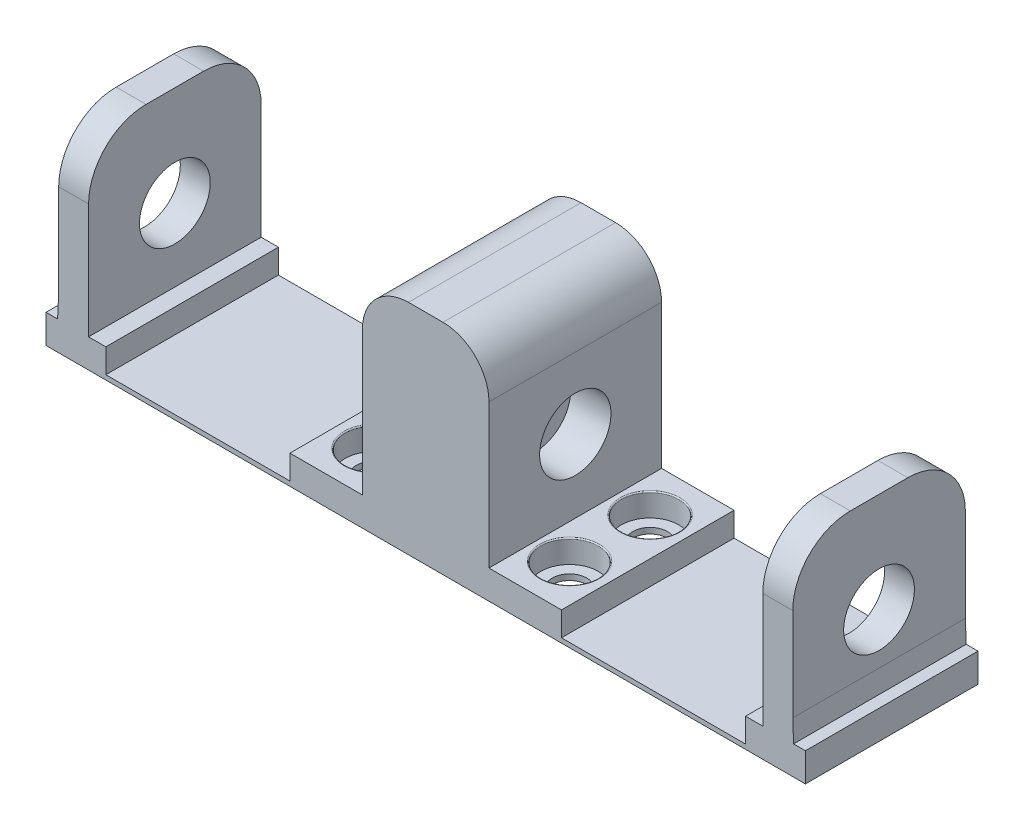
from build123d import *

# Parameters (mm, degrees)
SALIENTE_EXTRUIR1_DEPTH = 15
CROQUIS2_R              = 3.1
CORTAR_EXTRUIR1_DEPTH   = 3.5
CORTAR_EXTRUIR2_START   = -3.5
CROQUIS3_R              = 3.1
CORTAR_EXTRUIR2_DEPTH   = 3.5
CROQUIS4_R              = 2.5
CORTAR_EXTRUIR3_DEPTH   = 2
REDONDEO1_R             = 0.1
CROQUIS5_R              = 1.5
CORTAR_EXTRUIR4_DEPTH   = 26.089838581
CROQUIS6_W              = 15
CROQUIS6_H              = 2.5
SALIENTE_EXTRUIR2_DEPTH = 21.5
CROQUIS7_W              = 15
CROQUIS7_H              = 2.5
SALIENTE_EXTRUIR3_DEPTH = 21.5
CROQUIS8_W              = 2.6
CROQUIS8_H              = 15
SALIENTE_EXTRUIR4_DEPTH = 15
REDONDEO4_R             = 5
REDONDEO5_R             = 5
NERVIO1_REACH           = 37.15
CROQUIS17_WALL_W        = 74.218890724
CROQUIS17_WALL_H        = 15
NERVIO2_REACH           = 37.15
CROQUIS22_WALL_W        = 74.219791664
CROQUIS22_WALL_H        = 15
CROQUIS23_R             = 3.075
CORTAR_EXTRUIR5_DEPTH   = 7
CORTAR_EXTRUIR6_START   = -7
CROQUIS24_R             = 3.075
CORTAR_EXTRUIR6_DEPTH   = 7
CROQUIS34_W             = 16
CROQUIS34_H             = 2.1
CORTAR_EXTRUIR7_DEPTH   = 38.473323845
CROQUIS35_R             = 1.5
CORTAR_EXTRUIR8_DEPTH   = 2.2


with BuildPart() as part:
    # Croquis1 → Saliente-Extruir1 (new body)
    with BuildSketch(Plane.XY):
        with BuildLine():
            Line((-1.5, 9.5), (1.5, 9.5))
            ThreePointArc((1.5, 9.5), (4.328427125, 8.328427125), (5.5, 5.5))
            Line((5.5, 5.5), (5.5, -7))
            Line((5.5, -7), (11.5, -7))
            Line((11.5, -7), (11.5, -9.5))
            Line((11.5, -9.5), (5.5, -9.5))
            Line((5.5, -9.5), (-5.5, -9.5))
            Line((-5.5, -9.5), (-11.5, -9.5))
            Line((-11.5, -9.5), (-11.5, -7))
            Line((-11.5, -7), (-5.5, -7))
            Line((-5.5, -7), (-5.5, 5.5))
            ThreePointArc((-5.5, 5.5), (-4.328427125, 8.328427125), (-1.5, 9.5))
        make_face()
    extrude(amount=-SALIENTE_EXTRUIR1_DEPTH)

    # Croquis2 → Cortar-Extruir1 (cut)
    with BuildSketch(Plane(origin=(5.5, 0, 0), x_dir=(0, 0, -1), z_dir=(1, 0, 0))):
        with Locations((7.5, -0.68)):
            Circle(CROQUIS2_R)
    extrude(amount=-CORTAR_EXTRUIR1_DEPTH, mode=Mode.SUBTRACT)

    # Croquis3 → Cortar-Extruir2 (cut)
    with BuildSketch(Plane.ZY.offset(5.5).offset(CORTAR_EXTRUIR2_START)):
        with Locations((-7.5, -0.68)):
            Circle(CROQUIS3_R)
    extrude(amount=CORTAR_EXTRUIR2_DEPTH, mode=Mode.SUBTRACT)

    # Croquis4 → Cortar-Extruir3 (cut)
    with BuildSketch(Plane(origin=(0, -7, 0), x_dir=(1, 0, 0), z_dir=(0, 1, 0))):
        with Locations((-8.5, 11)):
            Circle(CROQUIS4_R)
        with Locations((-8.5, 4)):
            Circle(CROQUIS4_R)
        with Locations((8.5, 4)):
            Circle(CROQUIS4_R)
        with Locations((8.5, 11)):
            Circle(CROQUIS4_R)
    extrude(amount=-CORTAR_EXTRUIR3_DEPTH, mode=Mode.SUBTRACT)

    # Redondeo1
    redondeo1_edges = [part.edges().sort_by_distance(p)[0] for p in [
        (6, -7, -4),
        (6, -7, -11),
        (-11, -7, -4),
        (-11, -7, -11),
    ]]
    fillet(redondeo1_edges, radius=REDONDEO1_R)

    # Croquis5 → Cortar-Extruir4 (cut, through all)
    with BuildSketch(Plane(origin=(0, -7, 0), x_dir=(1, 0, 0), z_dir=(0, 1, 0))):
        with Locations((-8.5, 11)):
            Circle(CROQUIS5_R)
        with Locations((-8.5, 4)):
            Circle(CROQUIS5_R)
        with Locations((8.5, 4)):
            Circle(CROQUIS5_R)
        with Locations((8.5, 11)):
            Circle(CROQUIS5_R)
    extrude(amount=-CORTAR_EXTRUIR4_DEPTH, mode=Mode.SUBTRACT)

    # Croquis6 → Saliente-Extruir2 (add)
    with BuildSketch(Plane.ZY.offset(11.5)):
        with Locations((-7.5, -8.25)):
            Rectangle(CROQUIS6_W, CROQUIS6_H)
    extrude(amount=SALIENTE_EXTRUIR2_DEPTH)

    # Croquis7 → Saliente-Extruir3 (add)
    with BuildSketch(Plane(origin=(11.5, 0, 0), x_dir=(0, 0, -1), z_dir=(1, 0, 0))):
        with Locations((7.5, -8.25)):
            Rectangle(CROQUIS7_W, CROQUIS7_H)
    extrude(amount=SALIENTE_EXTRUIR3_DEPTH)

    # Croquis8 → Saliente-Extruir4 (add)
    with BuildSketch(Plane(origin=(0, -7, 0), x_dir=(1, 0, 0), z_dir=(0, 1, 0))):
        with Locations((-30.6, 7.5)):
            Rectangle(CROQUIS8_W, CROQUIS8_H)
        with Locations((30.6, 7.5)):
            Rectangle(CROQUIS8_W, CROQUIS8_H)
    extrude(amount=SALIENTE_EXTRUIR4_DEPTH)

    # Redondeo4
    redondeo4_edges = [part.edges().sort_by_distance(p)[0] for p in [
        (-30.6, 8, -15),
        (-30.6, 8, 0),
    ]]
    fillet(redondeo4_edges, radius=REDONDEO4_R)

    # Redondeo5
    redondeo5_edges = [part.edges().sort_by_distance(p)[0] for p in [
        (30.6, 8, -15),
        (30.6, 8, 0),
    ]]
    fillet(redondeo5_edges, radius=REDONDEO5_R)

    # Croquis17 wall → Nervio1 (add, up to next)
    with BuildSketch(Plane(origin=(31.936186969, -6.040917019, -7.5), x_dir=(0.037703973023, -0.999288952415, 0), z_dir=(0.999288952415, 0.037703973023, 0)), mode=Mode.PRIVATE) as nervio1_sk1:
        Rectangle(CROQUIS17_WALL_W, CROQUIS17_WALL_H)
    nervio1_tool1 = extrude(nervio1_sk1.sketch, amount=-NERVIO1_REACH, mode=Mode.PRIVATE) - part.part
    add(nervio1_tool1.solids().sort_by_distance((31.936186969, -6.040917019, -7.5))[0])

    # Croquis22 wall → Nervio2 (add, up to next)
    with BuildSketch(Plane(origin=(-31.946630364, -6.040917019, -7.5), x_dir=(0.048562374867, 0.998820151853, 0), z_dir=(-0.998820151853, 0.048562374867, 0)), mode=Mode.PRIVATE) as nervio2_sk1:
        Rectangle(CROQUIS22_WALL_W, CROQUIS22_WALL_H)
    nervio2_tool1 = extrude(nervio2_sk1.sketch, amount=-NERVIO2_REACH, mode=Mode.PRIVATE) - part.part
    add(nervio2_tool1.solids().sort_by_distance((-31.946630364, -6.040917019, -7.5))[0])

    # Croquis23 → Cortar-Extruir5 (cut)
    with BuildSketch(Plane(origin=(31.9, 0, 0), x_dir=(0, 0, -1), z_dir=(1, 0, 0))):
        with Locations((7.5, -0.68)):
            Circle(CROQUIS23_R)
    extrude(amount=-CORTAR_EXTRUIR5_DEPTH, mode=Mode.SUBTRACT)

    # Croquis24 → Cortar-Extruir6 (cut)
    with BuildSketch(Plane.ZY.offset(31.9).offset(CORTAR_EXTRUIR6_START)):
        with Locations((-7.5, -0.68)):
            Circle(CROQUIS24_R)
    extrude(amount=CORTAR_EXTRUIR6_DEPTH, mode=Mode.SUBTRACT)

    # Croquis34 → Cortar-Extruir7 (cut, through all)
    with BuildSketch(Plane.XY):
        with Locations((-19.8, -8.05)):
            Rectangle(CROQUIS34_W, CROQUIS34_H)
        with Locations((19.8, -8.05)):
            Rectangle(CROQUIS34_W, CROQUIS34_H)
    extrude(amount=-CORTAR_EXTRUIR7_DEPTH, mode=Mode.SUBTRACT)

    # Croquis35 → Cortar-Extruir8 (cut)
    with BuildSketch(Plane.XZ.offset(9.5)):
        with Locations((-31, -4)):
            Circle(CROQUIS35_R)
        with Locations((-31, -11)):
            Circle(CROQUIS35_R)
        with Locations((31, -11)):
            Circle(CROQUIS35_R)
        with Locations((31, -4)):
            Circle(CROQUIS35_R)
    extrude(amount=-CORTAR_EXTRUIR8_DEPTH, mode=Mode.SUBTRACT)


solid = part.part
